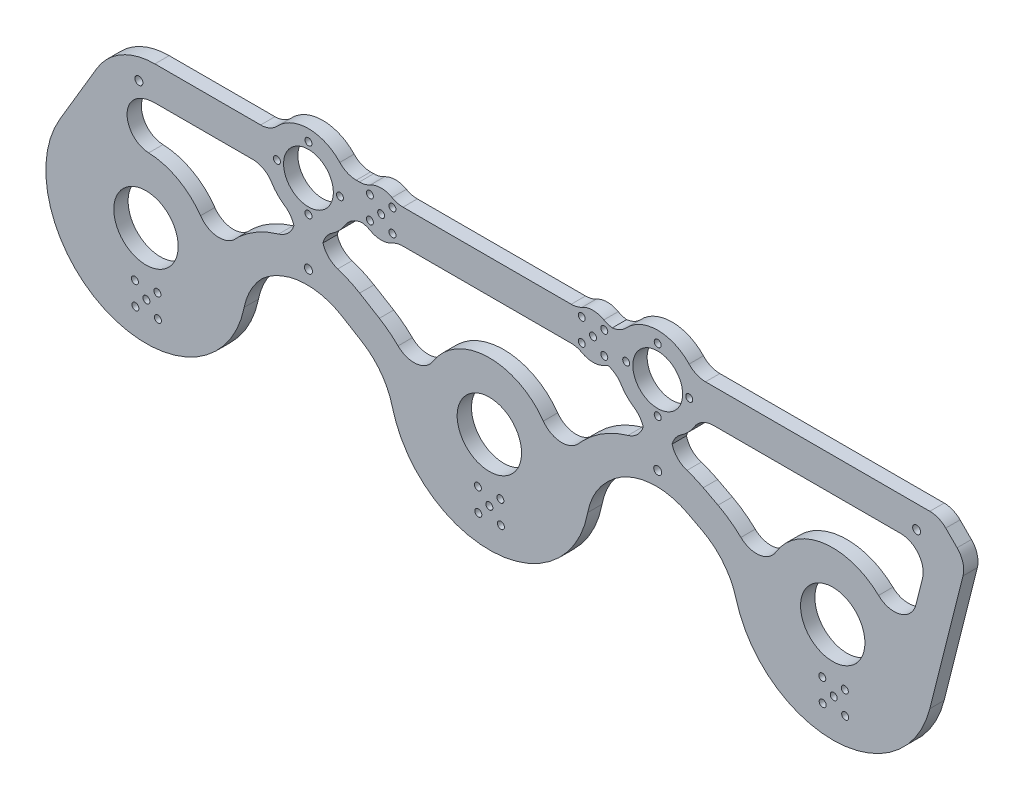
from build123d import *

# Parameters (mm, degrees)
SKETCH1_R           = 14.2875
BOSS_EXTRUDE1_DEPTH = 6.35
FILLET1_R           = 10
FILLET2_R           = 20
SKETCH2_R           = 1.778
CUT_EXTRUDE1_DEPTH  = 6.35
FILLET4_R           = 28.4734
BOSS_EXTRUDE2_DEPTH = 6.35
FILLET7_R           = 30
FILLET8_R           = 30
CUT_EXTRUDE4_DEPTH  = 6.35
FILLET9_R           = 10
SKETCH6_R           = 1.778
CUT_EXTRUDE5_DEPTH  = 10
CHAMFER1_SIZE       = 15
CHAMFER1_SIZE2      = 12.354196148
FILLET11_R          = 10
SKETCH7_R           = 11.049
SKETCH7_R_2         = 1.55
BOSS_EXTRUDE3_DEPTH = 6.35
SKETCH7_4_R         = 1.55
CUT_EXTRUDE6_DEPTH  = 10
FILLET12_R          = 10
SKETCH8_R           = 1.55
CUT_EXTRUDE7_DEPTH  = 10
SKETCH9_R           = 1.55
CUT_EXTRUDE8_DEPTH  = 10
SKETCH10_R          = 10
SKETCH10_R_2        = 1.55
BOSS_EXTRUDE4_DEPTH = 6.35
SKETCH10_4_R        = 1.55
CUT_EXTRUDE9_DEPTH  = 10
FILLET13_R          = 10
FILLET14_R          = 10


with BuildPart() as part:
    # Sketch1 → Boss-Extrude1 (new body)
    with BuildSketch(Plane.XY):
        with BuildLine():
            Line((76.2, 30), (19.765397885, -21.612188753))
            ThreePointArc((19.765397885, -21.612188753), (-7.664310495, -28.266871084), (-27.975511048, -8.66766623))
            Line((-27.975511048, -8.66766623), (-30.661018302, 0))
            Line((-30.661018302, 0), (-10.522036605, 65))
            Line((-10.522036605, 65), (355.6, 65))
            Line((355.6, 65), (332.775511048, -8.66766623))
            ThreePointArc((332.775511048, -8.66766623), (312.464310495, -28.266871084), (285.034602115, -21.612188753))
            Line((285.034602115, -21.612188753), (228.6, 30))
            Line((228.6, 30), (172.803916322, -24.185422532))
            ThreePointArc((172.803916322, -24.185422532), (152.4, -32.637001398), (131.996083678, -24.185422532))
            Line((131.996083678, -24.185422532), (76.2, 30))
        make_face()
        Circle(SKETCH1_R, mode=Mode.SUBTRACT)
        with Locations((152.4, -3.175)):
            Circle(SKETCH1_R, mode=Mode.SUBTRACT)
        with Locations((304.8, 0)):
            Circle(SKETCH1_R, mode=Mode.SUBTRACT)
    extrude(amount=BOSS_EXTRUDE1_DEPTH)

    # Fillet1
    fillet1_edges = [part.edges().sort_by_distance(p)[0] for p in [
        (-10.522036605, 65, 3.175),
        (355.6, 65, 3.175),
    ]]
    fillet(fillet1_edges, radius=FILLET1_R)

    # Fillet2
    fillet2_edges = [part.edges().sort_by_distance(p)[0] for p in [
        (228.6, 30, 3.175),
        (76.2, 30, 3.175),
    ]]
    fillet(fillet2_edges, radius=FILLET2_R)

    # Sketch2 → Cut-Extrude1 (cut)
    with BuildSketch(Plane(origin=(0, 0, 0), x_dir=(-1, 0, 0), z_dir=(0, 0, -1))):
        with Locations((-229.01165953, 23.51851186)):
            Circle(SKETCH2_R)
        with Locations((-342.03271747, 55)):
            Circle(SKETCH2_R)
        with Locations((-76.34605429, 23.51851186)):
            Circle(SKETCH2_R)
        with Locations(Location((3.151363828, 55, 0), (0, 0, 180))):
            Circle(SKETCH2_R)
    extrude(amount=-CUT_EXTRUDE1_DEPTH, mode=Mode.SUBTRACT)

    # Fillet4
    fillet4_edges = [part.edges().sort_by_distance(p)[0] for p in [
        (-30.661018302, 0, 3.175),
    ]]
    fillet(fillet4_edges, radius=FILLET4_R)

    # Sketch4 → Boss-Extrude2 (add)
    with BuildSketch(Plane.XY.offset(6.35)):
        with BuildLine():
            ThreePointArc((-12.703394916, 57.95951045), (-9.084528898, 63.04969268), (-3.151363828, 65))
            Line((-3.151363828, 65), (-13.151363828, 65))
            Line((-13.151363828, 65), (-38.240493846, 22.659813115))
            ThreePointArc((-38.240493846, 22.659813115), (-11.747607172, -42.869525607), (44.45, 0))
            Line((44.45, 0), (68.130864542, 20.996768873))
            ThreePointArc((68.130864542, 20.996768873), (65.048790473, 19.392687011), (62.290842982, 17.279399331))
            Line((62.290842982, 17.279399331), (19.765397885, -21.612188753))
            ThreePointArc((19.765397885, -21.612188753), (-7.664310495, -28.266871084), (-27.975511048, -8.66766623))
            Line((-27.975511048, -8.66766623), (-28.050159667, -8.426732485))
            ThreePointArc((-28.050159667, -8.426732485), (-29.325679471, 0), (-28.050159667, 8.426732485))
            Line((-28.050159667, 8.426732485), (-12.703394916, 57.95951045))
        make_face()
        with BuildLine():
            Line((367.03271747, 65), (342.03271747, 65))
            ThreePointArc((342.03271747, 65), (350.08241015, 60.93316507), (351.584748558, 52.04048955))
            Line((351.584748558, 52.04048955), (332.775511048, -8.66766623))
            ThreePointArc((332.775511048, -8.66766623), (312.464310495, -28.266871084), (285.034602115, -21.612188753))
            Line((285.034602115, -21.612188753), (242.509157018, 17.279399331))
            ThreePointArc((242.509157018, 17.279399331), (236.916143222, 20.892449631), (230.446997722, 22.469184326))
            ThreePointArc((230.446997722, 22.469184326), (229.01165953, 25.29651186), (227.576321337, 22.469184326))
            ThreePointArc((227.576321337, 22.469184326), (224.130268968, 21.915910418), (220.832871891, 20.771986703))
            Line((220.832871891, 20.771986703), (260.35, 0))
            ThreePointArc((260.35, 0), (299.323883091, -44.111389046), (347.900715123, -10.868801954))
            Line((347.900715123, -10.868801954), (367.03271747, 65))
        make_face()
        with BuildLine():
            ThreePointArc((74.888341467, 22.500495492), (71.444046197, 22.043232685), (68.130864542, 20.996768873))
            Line((68.130864542, 20.996768873), (107.95, -3.175))
            ThreePointArc((107.95, -3.175), (152.4, -47.625), (196.85, -3.175))
            Line((196.85, -3.175), (220.832871891, 20.771986703))
            ThreePointArc((220.832871891, 20.771986703), (217.784547298, 19.072249628), (215.078127257, 16.868462091))
            Line((215.078127257, 16.868462091), (172.803916322, -24.185422532))
            ThreePointArc((172.803916322, -24.185422532), (152.4, -32.637001398), (131.996083678, -24.185422532))
            Line((131.996083678, -24.185422532), (89.721872743, 16.868462091))
            ThreePointArc((89.721872743, 16.868462091), (84.206374965, 20.662880592), (77.747671619, 22.424549857))
            ThreePointArc((77.747671619, 22.424549857), (76.393262458, 25.295885031), (74.888341467, 22.500495492))
        make_face()
    extrude(amount=-BOSS_EXTRUDE2_DEPTH)

    # Fillet7
    fillet7_edges = [part.edges().sort_by_distance(p)[0] for p in [
        (-13.151363828, 65, 3.175),
        (220.832871891, 20.771986703, 3.175),
        (68.130864542, 20.996768873, 3.175),
    ]]
    fillet(fillet7_edges, radius=FILLET7_R)

    # Fillet8
    # the kernel refuses this fillet: 30 mm, written as the material it adds along each edge
    with BuildSketch(Plane(origin=(260.35, 0, 6.35), x_dir=(-0.885162761658156, 0.46528151196206646, 0), z_dir=(0, 0, -1))) as fillet8_piece_1:
        with BuildLine():
            CenterArc((15.190387643, -30), FILLET8_R, 90, 47.097799529)
            Line((-6.785115003, -9.577529937), (-7.224625056, -9.169080536))
            ThreePointArc((-7.224625056, -9.169080536), (-3.564628645, -4.666862713), (-0.531097657, 0.279168907))
            Line((-0.531097657, 0.279168907), (0, 0.6))
            Line((0, 0.6), (15.190387643, 0.6))
            Line((15.190387643, 0.6), (15.190387643, 0))
        make_face()
    extrude(amount=6.35)
    with BuildSketch(Plane(origin=(196.85, -3.175, 6.35), x_dir=(0.7076359952275091, 0.7065771707735629, 0), z_dir=(0, 0, -1))) as fillet8_piece_2:
        with BuildLine():
            CenterArc((10.639988457, 30), FILLET8_R, 235.569574261, 34.430425739)
            Line((-6.322164039, 5.255598963), (-6.661407089, 4.760710942))
            ThreePointArc((-6.661407089, 4.760710942), (-3.422869028, 2.312885725), (-0.424581597, -0.423946302))
            Line((-0.424581597, -0.423946302), (0, -0.6))
            Line((0, -0.6), (10.639988457, -0.6))
            Line((10.639988457, -0.6), (10.639988457, 0))
        make_face()
    extrude(amount=6.35)
    with BuildSketch(Plane(origin=(107.95, -3.175, 6.35), x_dir=(0.12361291259882386, -0.9923305134071185, 0), z_dir=(0, 0, -1))) as fillet8_piece_3:
        with BuildLine():
            CenterArc((14.697575308, 29.769915402), FILLET8_R, 218.360044666, 44.539295044)
            Line((-8.826217456, 11.151881833), (-9.296693311, 10.779521161))
            Line((-9.296693311, 10.779521161), (-0.470475855, -0.372360671))
            Line((-0.470475855, -0.372360671), (0.074167748, -0.595398308))
            ThreePointArc((0.074167748, -0.595398308), (5.494593965, -0.259091321), (10.915020182, -0.595398308))
            Line((10.915020182, -0.595398308), (10.98918793, 0))
        make_face()
    extrude(amount=6.35)
    with BuildSketch(Plane(origin=(44.45, 0, 6.35), x_dir=(0.7482385257878719, 0.6634298067819928, 0), z_dir=(0, 0, -1))) as fillet8_piece_4:
        with BuildLine():
            CenterArc((11.600303327, 29.927943547), FILLET8_R, 232.947582423, 33.080498338)
            Line((-6.476058983, 5.985405551), (-6.837586229, 5.506554792))
            ThreePointArc((-6.837586229, 5.506554792), (-3.496476043, 2.713070076), (-0.448943115, -0.398057884))
            Line((-0.448943115, -0.398057884), (0, -0.6))
            ThreePointArc((0, -0.6), (4.761138301, -0.6), (9.480716067, -0.598558871))
            Line((9.480716067, -0.598558871), (9.522276602, 0))
        make_face()
    extrude(amount=6.35)

    # Sketch5 → Cut-Extrude4 (cut)
    with BuildSketch(Plane.XY.offset(6.35)):
        with BuildLine():
            ThreePointArc((194.615491971, 15.791174318), (219.671246202, 28.439907305), (247.349132694, 23.779878807))
            Line((247.349132694, 23.779878807), (253.883257203, 20.345247955))
            ThreePointArc((253.883257203, 20.345247955), (268.053828361, 8.662729018), (276.376730704, -7.708453964))
            ThreePointArc((276.376730704, -7.708453964), (300.911734369, 29.192188859), (334.25, 0))
            ThreePointArc((334.25, 0), (334.02565596, -3.628158447), (333.356041853, -7.201039765))
            Line((333.356041853, -7.201039765), (347.780553627, 50))
            Line((347.780553627, 50), (3.943227293, 50))
            ThreePointArc((3.943227293, 50), (-3.483044778, 48.032669839), (-8.961326311, 42.646731085))
            Line((-8.961326311, 42.646731085), (-25.335940242, 15.01308203))
            ThreePointArc((-25.335940242, 15.01308203), (7.783285292, 28.402869046), (29.45, 0))
            ThreePointArc((29.45, 0), (29.304753726, -2.921285517), (28.870447601, -5.813755696))
            ThreePointArc((28.870447601, -5.813755696), (33.3473738, 6.60692021), (41.236376282, 17.193690161))
            ThreePointArc((41.236376282, 17.193690161), (67.178557893, 28.664360804), (94.828925818, 22.337416413))
            Line((94.828925818, 22.337416413), (103.576312064, 17.027411659))
            ThreePointArc((103.576312064, 17.027411659), (116.412331651, 5.308894344), (123.850000962, -10.39996055))
            ThreePointArc((123.850000962, -10.39996055), (148.759599724, 26.04913362), (181.85, -3.175))
            ThreePointArc((181.85, -3.175), (181.723796119, -5.898505311), (181.346266134, -8.598668216))
            ThreePointArc((181.346266134, -8.598668216), (185.780555552, 4.120523274), (193.780581259, 14.957512869))
            Line((193.780581259, 14.957512869), (194.615491971, 15.791174318))
        make_face()
    extrude(amount=-CUT_EXTRUDE4_DEPTH, mode=Mode.SUBTRACT)

    # Fillet9
    fillet9_edges = [part.edges().sort_by_distance(p)[0] for p in [
        (123.850000962, -10.39996055, 3.175),
    ]]
    fillet(fillet9_edges, radius=FILLET9_R)
    fillet9_2_edges = [part.edges().sort_by_distance(p)[0] for p in [
        (181.346266134, -8.598668216, 3.175),
    ]]
    fillet(fillet9_2_edges, radius=FILLET9_R)
    fillet9_3_edges = [part.edges().sort_by_distance(p)[0] for p in [
        (276.376730704, -7.708453964, 3.175),
    ]]
    fillet(fillet9_3_edges, radius=FILLET9_R)
    fillet9_4_edges = [part.edges().sort_by_distance(p)[0] for p in [
        (347.780553627, 50, 3.175),
    ]]
    fillet(fillet9_4_edges, radius=FILLET9_R)
    fillet9_5_edges = [part.edges().sort_by_distance(p)[0] for p in [
        (28.870447601, -5.813755696, 3.175),
    ]]
    fillet(fillet9_5_edges, radius=FILLET9_R)
    fillet9_6_edges = [part.edges().sort_by_distance(p)[0] for p in [
        (333.356041853, -7.201039765, 3.175),
    ]]
    fillet(fillet9_6_edges, radius=FILLET9_R)
    fillet9_7_edges = [part.edges().sort_by_distance(p)[0] for p in [
        (-25.335940242, 15.01308203, 3.175),
    ]]
    fillet(fillet9_7_edges, radius=FILLET9_R)

    # Sketch6 → Cut-Extrude5 (cut)
    with BuildSketch(Plane.XY.offset(6.35)):
        with Locations((72.107287937, 20.164023691)):
            Circle(SKETCH6_R)
        with Locations((227.125599237, 20.32759964)):
            Circle(SKETCH6_R)
    extrude(amount=-CUT_EXTRUDE5_DEPTH, mode=Mode.SUBTRACT)

    # Chamfer1
    chamfer1_edges = [part.edges().sort_by_distance(p)[0] for p in [
        (367.03271747, 65, 3.175),
    ]]
    chamfer1_side = [part.faces().sort_by_distance(p)[0] for p in [
        (185.487972381, 65, 3.175),
    ]]
    chamfer(chamfer1_edges, length=CHAMFER1_SIZE, length2=CHAMFER1_SIZE2, reference=chamfer1_side[0])

    # Fillet11
    fillet11_edges = [part.edges().sort_by_distance(p)[0] for p in [
        (364.011900569, 53.020816901, 3.175),
        (352.03271747, 65, 3.175),
    ]]
    fillet(fillet11_edges, radius=FILLET11_R)

    # Sketch7 → Boss-Extrude3 (add)
    # profile 1 of 2: a face of its own
    with BuildSketch(Plane.XY.offset(6.35)):
        with BuildLine():
            Line((66.107287937, 37.083578453), (65.950446734, 28.529450097))
            ThreePointArc((65.950446734, 28.529450097), (72.118304444, 28.865648238), (78.274094162, 28.35403231))
            Line((78.274094162, 28.35403231), (78.107287937, 37.083578453))
            ThreePointArc((78.107287937, 37.083578453), (72.107287937, 74.214023691), (66.107287937, 37.083578453))
        make_face()
        with Locations((72.107287937, 55.164023691)):
            Circle(SKETCH7_R, mode=Mode.SUBTRACT)
        with Locations((72.107287937, 69.159423691)):
            Circle(SKETCH7_R_2, mode=Mode.SUBTRACT)
        with Locations((86.102687937, 55.164023691)):
            Circle(SKETCH7_R_2, mode=Mode.SUBTRACT)
        with Locations((72.107287937, 41.168623691)):
            Circle(SKETCH7_R_2, mode=Mode.SUBTRACT)
        with Locations((58.111887937, 55.164023691)):
            Circle(SKETCH7_R_2, mode=Mode.SUBTRACT)
    # profile 2 of 2: a face of its own
    with BuildSketch(Plane.XY.offset(6.35)):
        with BuildLine():
            Line((221.125599237, 37.083578453), (221.125599237, 27.262229933))
            ThreePointArc((221.125599237, 27.262229933), (227.125599237, 27.664023691), (233.125599237, 27.262229933))
            Line((233.125599237, 27.262229933), (233.125599237, 37.083578453))
            ThreePointArc((233.125599237, 37.083578453), (227.125599237, 74.214023691), (221.125599237, 37.083578453))
        make_face()
        with Locations((227.125599237, 55.164023691)):
            Circle(SKETCH7_R, mode=Mode.SUBTRACT)
        with Locations((227.125599237, 69.159423691)):
            Circle(SKETCH7_R_2, mode=Mode.SUBTRACT)
        with Locations((241.120999237, 55.164023691)):
            Circle(SKETCH7_R_2, mode=Mode.SUBTRACT)
        with Locations((227.125599237, 41.168623691)):
            Circle(SKETCH7_R_2, mode=Mode.SUBTRACT)
        with Locations((213.130199237, 55.164023691)):
            Circle(SKETCH7_R_2, mode=Mode.SUBTRACT)
    extrude(amount=-BOSS_EXTRUDE3_DEPTH)

    # Sketch7<4> → Cut-Extrude6 (cut)
    with BuildSketch(Plane.XY.offset(6.35)):
        with BuildLine():
            ThreePointArc((67.07400163, 65), (61.570718023, 58.489846213), (62.33931679, 50))
            Line((62.33931679, 50), (81.875259083, 50))
            ThreePointArc((81.875259083, 50), (82.831249756, 52.503752295), (83.156287937, 55.164023691))
            ThreePointArc((83.156287937, 55.164023691), (81.533134886, 60.928900992), (77.140574244, 65))
            Line((77.140574244, 65), (67.07400163, 65))
        make_face()
        with BuildLine():
            Line((81.875259083, 50), (62.33931679, 50))
            ThreePointArc((62.33931679, 50), (72.107287937, 44.115023691), (81.875259083, 50))
        make_face()
        with BuildLine():
            ThreePointArc((77.140574244, 65), (72.107287937, 66.213023691), (67.07400163, 65))
            Line((67.07400163, 65), (77.140574244, 65))
        make_face()
        with Locations((58.111887937, 55.164023691)):
            Circle(SKETCH7_4_R)
        with Locations((86.102687937, 55.164023691)):
            Circle(SKETCH7_4_R)
        with BuildLine():
            Line((232.158885544, 65), (222.092312929, 65))
            ThreePointArc((222.092312929, 65), (216.589029323, 58.489846213), (217.35762809, 50))
            Line((217.35762809, 50), (236.893570383, 50))
            ThreePointArc((236.893570383, 50), (237.849561056, 52.503752295), (238.174599237, 55.164023691))
            ThreePointArc((238.174599237, 55.164023691), (236.551446186, 60.928900992), (232.158885544, 65))
        make_face()
        with BuildLine():
            ThreePointArc((232.158885544, 65), (227.125599237, 66.213023691), (222.092312929, 65))
            Line((222.092312929, 65), (232.158885544, 65))
        make_face()
        with BuildLine():
            Line((236.893570383, 50), (217.35762809, 50))
            ThreePointArc((217.35762809, 50), (227.125599237, 44.115023691), (236.893570383, 50))
        make_face()
        with Locations((213.130199237, 55.164023691)):
            Circle(SKETCH7_4_R)
        with Locations((241.120999237, 55.164023691)):
            Circle(SKETCH7_4_R)
    extrude(amount=-CUT_EXTRUDE6_DEPTH, mode=Mode.SUBTRACT)

    # Fillet12
    # the kernel refuses this fillet: 10 mm, written as the material it adds along each edge
    with BuildSketch(Plane(origin=(53.770566329, 50, 0), x_dir=(0.40030675320951403, -0.916381199793436, 0), z_dir=(0, 0, 1))) as fillet12_piece_1:
        with BuildLine():
            CenterArc((6.58527951, -9.905837535), FILLET12_R, 97.868970454, 58.533673045)
            Line((-2.578532488, -5.902770003), (0, 0))
            ThreePointArc((0, 0), (2.608099265, -0.179379496), (5.216198531, 0))
        make_face()
    extrude(amount=6.35)
    with BuildSketch(Plane(origin=(66.107287937, 37.083578453, 6.35), x_dir=(-0.018332066086736078, -0.9998319535566922, 0), z_dir=(0, 0, -1))) as fillet12_piece_2:
        with BuildLine():
            CenterArc((6.275443901, 10), FILLET12_R, 212.638048423, 57.361951577)
            ThreePointArc((-2.145500396, 4.606698863), (-0.918449346, 2.375212722), (0, 0))
            Line((0, 0), (6.275443901, 0))
        make_face()
    extrude(amount=6.35)
    with BuildSketch(Plane(origin=(78.107287937, 37.083578453, 6.35), x_dir=(0.8985710736646946, 0.43882801366033847, 0), z_dir=(0, 0, -1))) as fillet12_piece_3:
        with BuildLine():
            CenterArc((6.420351206, 9.910516101), FILLET12_R, 204.934439644, 57.394869746)
            Line((-2.647556514, 5.694706621), (0, 0))
            ThreePointArc((0, 0), (2.542779428, 0.170466828), (5.085558856, 0))
        make_face()
    extrude(amount=6.35)
    with BuildSketch(Plane(origin=(55.792997574, 65, 0), x_dir=(0.6028638220218184, 0.7978441026273524, 0), z_dir=(0, 0, 1))) as fillet12_piece_4:
        with BuildLine():
            CenterArc((5.018861942, 9.945414502), FILLET12_R, 217.07528031, 46.935447927)
            Line((-2.959579085, 3.916776281), (0, 0))
            ThreePointArc((0, 0), (1.98771975, 0.103985374), (3.9754395, 0))
        make_face()
    extrude(amount=6.35)
    with BuildSketch(Plane(origin=(65.950446734, 28.529450097, 6.35), x_dir=(-0.9794105605308369, -0.20187856231079146, 0), z_dir=(0, 0, -1))) as fillet12_piece_5:
        with BuildLine():
            CenterArc((8.004817634, 9.967909959), FILLET12_R, 192.697242638, 72.711422444)
            Line((-1.750633595, 7.769917394), (0, 0))
            ThreePointArc((0, 0), (3.602167935, 0.144405185), (7.20433587, 0))
        make_face()
    extrude(amount=6.35)
    with BuildSketch(Plane(origin=(78.274094162, 28.35403231, 6.35), x_dir=(-0.019104748235527328, 0.9998174876420481, 0), z_dir=(0, 0, -1))) as fillet12_piece_6:
        with BuildLine():
            CenterArc((7.746919257, 10), FILLET12_R, 198.712277687, 71.287722313)
            ThreePointArc((-1.724496274, 6.791840428), (-0.729844901, 3.429538331), (0, 0))
            Line((0, 0), (7.746919257, 0))
        make_face()
    extrude(amount=6.35)
    with BuildSketch(Plane(origin=(221.125599237, 28.636027619, 0), x_dir=(-0.9801292451849115, -0.1983599322778052, 0), z_dir=(0, 0, 1))) as fillet12_piece_7:
        with BuildLine():
            CenterArc((8.185713803, -9.966440734), FILLET12_R, 94.695322094, 73.863609206)
            Line((-1.615578649, -7.982841411), (0, 0))
            ThreePointArc((0, 0), (3.683571211, -0.151016699), (7.367142423, 0))
        make_face()
    extrude(amount=6.35)
    with BuildSketch(Plane(origin=(233.125599237, 28.443850972, 0), x_dir=(0, 1, 0), z_dir=(0, 0, 1))) as fillet12_piece_8:
        with BuildLine():
            CenterArc((7.902536613, -10), FILLET12_R, 90, 72.308402056)
            ThreePointArc((-1.624523942, -6.96106644), (-0.673825275, -3.512840587), (0, 0))
            Line((0, 0), (7.902536613, 0))
        make_face()
    extrude(amount=6.35)
    with BuildSketch(Plane(origin=(245.462320844, 50, 0), x_dir=(1, 0, 0), z_dir=(0, 0, 1))) as fillet12_piece_9:
        with BuildLine():
            CenterArc((6.441391426, -10), FILLET12_R, 90, 58.533673045)
            ThreePointArc((-2.088079498, -4.780026268), (-0.879659752, -2.461819958), (0, 0))
            Line((0, 0), (6.441391426, 0))
        make_face()
    extrude(amount=6.35)
    with BuildSketch(Plane(origin=(221.125599237, 37.083578453, 6.35), x_dir=(0, -1, 0), z_dir=(0, 0, -1))) as fillet12_piece_10:
        with BuildLine():
            CenterArc((6.166255569, 10), FILLET12_R, 213.420164974, 56.579835026)
            ThreePointArc((-2.180285157, 4.492254733), (-0.942316034, 2.31787397), (0, 0))
            Line((0, 0), (6.166255569, 0))
        make_face()
    extrude(amount=6.35)
    with BuildSketch(Plane(origin=(233.125599237, 37.083578453, 6.35), x_dir=(0.899639328293552, 0.43663380421988235, 0), z_dir=(0, 0, -1))) as fillet12_piece_11:
        with BuildLine():
            CenterArc((6.303997656, 9.91374406), FILLET12_R, 205.889301025, 56.579835026)
            Line((-2.692395627, 5.547406018), (0, 0))
            ThreePointArc((0, 0), (2.496697616, 0.164317566), (4.993395233, 0))
        make_face()
    extrude(amount=6.35)
    with BuildSketch(Plane(origin=(243.4398896, 65, 0), x_dir=(-0.6028638220218127, 0.7978441026273568, 0), z_dir=(0, 0, 1))) as fillet12_piece_12:
        with BuildLine():
            CenterArc((5.018861942, -9.945414502), FILLET12_R, 95.989271763, 46.935447927)
            Line((-2.959579085, -3.916776281), (0, 0))
            ThreePointArc((0, 0), (1.98771975, -0.103985374), (3.9754395, 0))
        make_face()
    extrude(amount=6.35)

    # Sketch8 → Cut-Extrude7 (cut)
    with BuildSketch(Plane.XY.offset(6.35)):
        with Locations((104.38540097, 57.5)):
            Circle(SKETCH8_R)
        with Locations((99.38540097, 62.5)):
            Circle(SKETCH8_R)
        with Locations((99.38540097, 52.5)):
            Circle(SKETCH8_R)
        with Locations((109.38540097, 62.5)):
            Circle(SKETCH8_R)
        with Locations((109.38540097, 52.5)):
            Circle(SKETCH8_R)
        with Locations((193.402108858, 62.5)):
            Circle(SKETCH8_R)
        with Locations((193.402108858, 52.5)):
            Circle(SKETCH8_R)
        with Locations((203.402108858, 52.5)):
            Circle(SKETCH8_R)
        with Locations((198.402108858, 57.5)):
            Circle(SKETCH8_R)
        with Locations((203.402108858, 62.5)):
            Circle(SKETCH8_R)
    extrude(amount=-CUT_EXTRUDE7_DEPTH, mode=Mode.SUBTRACT)

    # Sketch9 → Cut-Extrude8 (cut)
    with BuildSketch(Plane(origin=(0, 0, 0), x_dir=(-1, 0, 0), z_dir=(0, 0, -1))):
        with Locations((-300.164304556, -22.577872525)):
            Circle(SKETCH9_R)
        with Locations((-310.162998373, -22.416249652)):
            Circle(SKETCH9_R)
        with Locations((-305.244462901, -27.496407997)):
            Circle(SKETCH9_R)
        with Locations((-310.324621246, -32.414943469)):
            Circle(SKETCH9_R)
        with Locations((-300.325927429, -32.576566342)):
            Circle(SKETCH9_R)
        with Locations((4.932329788, -22.614213935)):
            Circle(SKETCH9_R)
        with Locations((-5.065092811, -22.387186644)):
            Circle(SKETCH9_R)
        with Locations((-0.179895157, -27.499411589)):
            Circle(SKETCH9_R)
        with Locations((-5.292120102, -32.384609242)):
            Circle(SKETCH9_R)
        with Locations((4.705302496, -32.611636534)):
            Circle(SKETCH9_R)
    extrude(amount=-CUT_EXTRUDE8_DEPTH, mode=Mode.SUBTRACT)

    # Sketch10 → Boss-Extrude4 (add)
    # profile 1 of 2: a face of its own
    with BuildSketch(Plane.XY.offset(6.35)):
        with Locations((104.38540097, 57.5)):
            Circle(SKETCH10_R)
        with Locations((99.38540097, 62.5)):
            Circle(SKETCH10_R_2, mode=Mode.SUBTRACT)
        with Locations((104.38540097, 57.5)):
            Circle(SKETCH10_R_2, mode=Mode.SUBTRACT)
        with Locations((99.38540097, 52.5)):
            Circle(SKETCH10_R_2, mode=Mode.SUBTRACT)
        with Locations((109.38540097, 62.5)):
            Circle(SKETCH10_R_2, mode=Mode.SUBTRACT)
        with Locations((109.38540097, 52.5)):
            Circle(SKETCH10_R_2, mode=Mode.SUBTRACT)
    # profile 2 of 2: a face of its own
    with BuildSketch(Plane.XY.offset(6.35)):
        with Locations((198.402108858, 57.5)):
            Circle(SKETCH10_R)
        with Locations((203.402108858, 52.5)):
            Circle(SKETCH10_R_2, mode=Mode.SUBTRACT)
        with Locations((193.402108858, 52.5)):
            Circle(SKETCH10_R_2, mode=Mode.SUBTRACT)
        with Locations((193.402108858, 62.5)):
            Circle(SKETCH10_R_2, mode=Mode.SUBTRACT)
        with Locations((198.402108858, 57.5)):
            Circle(SKETCH10_R_2, mode=Mode.SUBTRACT)
        with Locations((203.402108858, 62.5)):
            Circle(SKETCH10_R_2, mode=Mode.SUBTRACT)
    extrude(amount=-BOSS_EXTRUDE4_DEPTH)

    # Sketch10<4> → Cut-Extrude9 (cut)
    with BuildSketch(Plane.XY.offset(6.35)):
        with Locations((152.4, -30.674411589)):
            Circle(SKETCH10_4_R)
        with Locations((147.287775055, -25.789213935)):
            Circle(SKETCH10_4_R)
        with Locations((157.285197654, -25.562186644)):
            Circle(SKETCH10_4_R)
        with Locations((157.512224945, -35.559609242)):
            Circle(SKETCH10_4_R)
        with Locations((147.514802346, -35.786636534)):
            Circle(SKETCH10_4_R)
    extrude(amount=-CUT_EXTRUDE9_DEPTH, mode=Mode.SUBTRACT)

    # Fillet13
    # the kernel refuses this fillet: 10 mm, written as the material it adds along each edge
    with BuildSketch(Plane(origin=(90.444009545, 50, 0), x_dir=(1, 0, 0), z_dir=(0, 0, 1))) as fillet13_piece_1:
        with BuildLine():
            CenterArc((6.441391426, -10), FILLET13_R, 90, 58.533673045)
            ThreePointArc((-2.088079498, -4.780026268), (-0.879659752, -2.461819958), (0, 0))
            Line((0, 0), (6.441391426, 0))
        make_face()
    extrude(amount=6.35)
    with BuildSketch(Plane(origin=(88.4215783, 65, 0), x_dir=(1, 0, 0), z_dir=(0, 0, 1))) as fillet13_piece_2:
        with BuildLine():
            CenterArc((4.909200016, 10), FILLET13_R, 223.064552073, 46.935447927)
            ThreePointArc((-2.396648651, 3.171780961), (-1.115360208, 1.648579501), (0, 0))
            Line((0, 0), (4.909200016, 0))
        make_face()
    extrude(amount=6.35)
    with BuildSketch(Plane(origin=(110.999779248, 50, 0), x_dir=(1, 0, 0), z_dir=(0, 0, 1))) as fillet13_piece_3:
        with BuildLine():
            CenterArc((3.068080088, -10), FILLET13_R, 90, 28.955024372)
            ThreePointArc((-1.773149095, -1.25), (-0.852576427, -0.67322699), (0, 0))
            Line((0, 0), (3.068080088, 0))
        make_face()
    extrude(amount=6.35)
    with BuildSketch(Plane(origin=(97.771022693, 50, 0), x_dir=(0.8173226989884894, -0.5761801851141454, 0), z_dir=(0, 0, 1))) as fillet13_piece_4:
        with BuildLine():
            CenterArc((3.254190353, -9.940993943), FILLET13_R, 96.227298869, 28.955024372)
            Line((-2.507611498, -1.767766953), (0, 0))
            ThreePointArc((0, 0), (1.084730118, -0.059006057), (2.169460235, 0))
        make_face()
    extrude(amount=6.35)
    with BuildSketch(Plane(origin=(97.771022693, 65, 0), x_dir=(0.8173226989884894, 0.5761801851141454, 0), z_dir=(0, 0, 1))) as fillet13_piece_5:
        with BuildLine():
            CenterArc((3.254190353, 9.940993943), FILLET13_R, 234.817676759, 28.955024372)
            Line((-2.507611498, 1.767766953), (0, 0))
            ThreePointArc((0, 0), (1.084730118, 0.059006057), (2.169460235, 0))
        make_face()
    extrude(amount=6.35)
    with BuildSketch(Plane(origin=(110.999779248, 65, 0), x_dir=(1, 0, 0), z_dir=(0, 0, 1))) as fillet13_piece_6:
        with BuildLine():
            CenterArc((3.068080088, 10), FILLET13_R, 241.044975628, 28.955024372)
            ThreePointArc((-1.773149095, 1.25), (-0.852576427, 0.67322699), (0, 0))
            Line((0, 0), (3.068080088, 0))
        make_face()
    extrude(amount=6.35)

    # Fillet14
    # the kernel refuses this fillet: 10 mm, written as the material it adds along each edge
    with BuildSketch(Plane(origin=(208.788877629, 50, 0), x_dir=(0.4003067532095219, -0.9163811997934325, 0), z_dir=(0, 0, 1))) as fillet14_piece_1:
        with BuildLine():
            CenterArc((6.58527951, -9.905837535), FILLET14_R, 97.868970454, 58.533673045)
            Line((-2.578532488, -5.902770003), (0, 0))
            ThreePointArc((0, 0), (2.608099265, -0.179379496), (5.216198531, 0))
        make_face()
    extrude(amount=6.35)
    with BuildSketch(Plane(origin=(210.811308874, 65, 0), x_dir=(-1, 0, 0), z_dir=(0, 0, 1))) as fillet14_piece_2:
        with BuildLine():
            CenterArc((4.909200016, -10), FILLET14_R, 90, 46.935447927)
            ThreePointArc((-2.396648651, -3.171780961), (-1.115360208, -1.648579501), (0, 0))
            Line((0, 0), (4.909200016, 0))
        make_face()
    extrude(amount=6.35)
    with BuildSketch(Plane(origin=(205.016487135, 50, 0), x_dir=(1, 0, 0), z_dir=(0, 0, 1)), Plane(origin=(191.78773058, 65, 0), x_dir=(-1, 0, 0), z_dir=(0, 0, 1))) as fillet14_piece_3:
        with BuildLine():
            CenterArc((3.068080088, -10), FILLET14_R, 90, 28.955024372)
            ThreePointArc((-1.773149095, -1.25), (-0.852576427, -0.67322699), (0, 0))
            Line((0, 0), (3.068080088, 0))
        make_face()
    extrude(amount=6.35)
    with BuildSketch(Plane(origin=(191.78773058, 50, 0), x_dir=(0.8173226989884894, -0.5761801851141454, 0), z_dir=(0, 0, 1)), Plane(origin=(205.016487135, 65, 0), x_dir=(-0.8173226989884894, 0.5761801851141454, 0), z_dir=(0, 0, 1))) as fillet14_piece_4:
        with BuildLine():
            CenterArc((3.254190353, -9.940993943), FILLET14_R, 96.227298869, 28.955024372)
            Line((-2.507611498, -1.767766953), (0, 0))
            ThreePointArc((0, 0), (1.084730118, -0.059006057), (2.169460235, 0))
        make_face()
    extrude(amount=6.35)


solid = part.part
